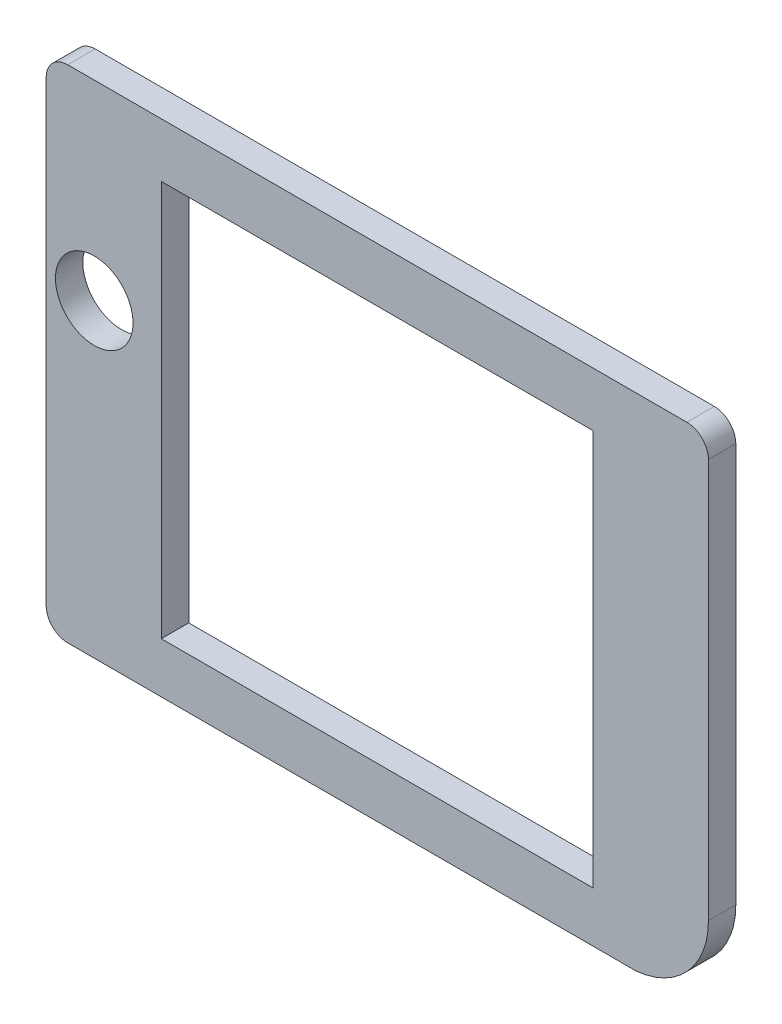
from build123d import *

# Parameters (mm, degrees)
SKETCH1_W   = 50.090098238
SKETCH1_H   = 45.932062837
SKETCH1_R   = 4.5
BEZEL_DEPTH = 3.18


with BuildPart() as part:
    # Sketch1 → Bezel (new body)
    with BuildSketch(Plane.XY):
        with BuildLine():
            ThreePointArc((38.389642662, 59.990077479), (37.657409615, 61.757844432), (35.889642662, 62.490077479))
            Line((35.889642662, 62.490077479), (-35.919151108, 62.490077479))
            ThreePointArc((-35.919151108, 62.490077479), (-37.686918061, 61.757844432), (-38.419151108, 59.990077479))
            Line((-38.419151108, 59.990077479), (-38.419151108, 6.918014642))
            ThreePointArc((-38.419151108, 6.918014642), (-37.686918061, 5.150247689), (-35.919151108, 4.418014642))
            Line((-35.919151108, 4.418014642), (29.997375098, 4.418014642))
            ThreePointArc((29.997375098, 4.418014642), (35.990372343, 7.41277043), (38.389642662, 13.668014642))
            Line((38.389642662, 13.668014642), (38.389642662, 59.990077479))
        make_face()
        with Locations((-0.014754223, 33.23404606)):
            Rectangle(SKETCH1_W, SKETCH1_H, mode=Mode.SUBTRACT)
        with Locations((-32.845865367, 40.325993685)):
            Circle(SKETCH1_R, mode=Mode.SUBTRACT)
    extrude(amount=BEZEL_DEPTH)


solid = part.part
